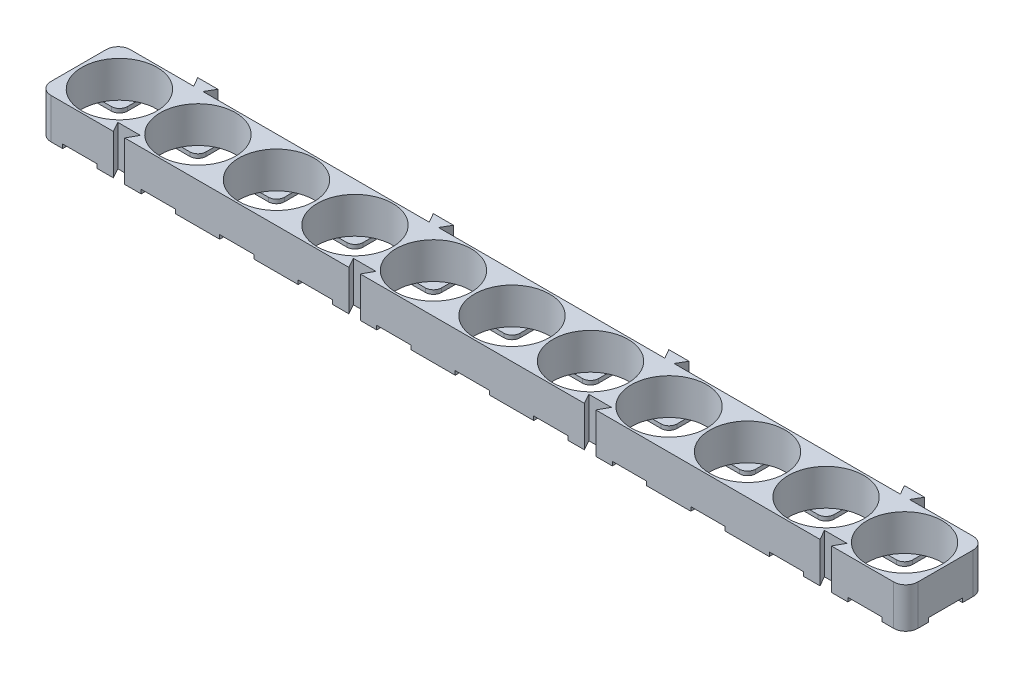
from build123d import *

# Parameters (mm, degrees)
SKETCH3_R           = 9.35
BOSS_EXTRUDE3_DEPTH = 10
SKETCH3_4_R         = 9.35
BOSS_EXTRUDE6_DEPTH = 1
SKETCH8_W           = 215.3
SKETCH8_H           = 8.5
SKETCH8_W_2         = 8.5
SKETCH8_H_2         = 19.7
CUT_EXTRUDE4_DEPTH  = 206.709412765
FILLET3_R           = 2
FILLET4_R           = 3


with BuildPart() as part:
    # Sketch3 → Boss-Extrude3 (new body)
    with BuildSketch(Plane(origin=(0, 0, 0), x_dir=(1, 0, 0), z_dir=(0, 1, 0))):
        Polygon((8.606773133, 9.85), (-10.15, 9.85), (-10.15, -9.85), (8.335772629, -9.85), (6.95, -7.35), (12.55, -7.35), (11.164227371, -9.85), (66.835772629, -9.85), (65.45, -7.35), (71.05, -7.35), (69.664227371, -9.85), (125.335772629, -9.85), (123.95, -7.35), (129.55, -7.35), (128.164227371, -9.85), (183.835772629, -9.85), (182.45, -7.35), (188.05, -7.35), (186.664227371, -9.85), (205.15, -9.85), (205.15, 9.85), (186.393226867, 9.85), (187.75, 12.2), (182.75, 12.2), (184.106773133, 9.85), (127.893226867, 9.85), (129.25, 12.2), (124.25, 12.2), (125.606773133, 9.85), (69.393226867, 9.85), (70.75, 12.2), (65.75, 12.2), (67.106773133, 9.85), (10.893226867, 9.85), (12.25, 12.2), (7.25, 12.2), align=None)
        Circle(SKETCH3_R, mode=Mode.SUBTRACT)
        with Locations((19.5, 0)):
            Circle(SKETCH3_R, mode=Mode.SUBTRACT)
        with Locations((39, 0)):
            Circle(SKETCH3_R, mode=Mode.SUBTRACT)
        with Locations((58.5, 0)):
            Circle(SKETCH3_R, mode=Mode.SUBTRACT)
        with Locations((78, 0)):
            Circle(SKETCH3_R, mode=Mode.SUBTRACT)
        with Locations((97.5, 0)):
            Circle(SKETCH3_R, mode=Mode.SUBTRACT)
        with Locations((117, 0)):
            Circle(SKETCH3_R, mode=Mode.SUBTRACT)
        with Locations((136.5, 0)):
            Circle(SKETCH3_R, mode=Mode.SUBTRACT)
        with Locations((156, 0)):
            Circle(SKETCH3_R, mode=Mode.SUBTRACT)
        with Locations((175.5, 0)):
            Circle(SKETCH3_R, mode=Mode.SUBTRACT)
        with Locations((195, 0)):
            Circle(SKETCH3_R, mode=Mode.SUBTRACT)
    extrude(amount=BOSS_EXTRUDE3_DEPTH)

    # Sketch3<4> → Boss-Extrude6 (add)
    with BuildSketch(Plane(origin=(0, 0, 0), x_dir=(1, 0, 0), z_dir=(0, 1, 0))):
        Circle(SKETCH3_4_R)
        with Locations((19.5, 0)):
            Circle(SKETCH3_4_R)
        with Locations((39, 0)):
            Circle(SKETCH3_4_R)
        with Locations((58.5, 0)):
            Circle(SKETCH3_4_R)
        with Locations((78, 0)):
            Circle(SKETCH3_4_R)
        with Locations((97.5, 0)):
            Circle(SKETCH3_4_R)
        with Locations((117, 0)):
            Circle(SKETCH3_4_R)
        with Locations((136.5, 0)):
            Circle(SKETCH3_4_R)
        with Locations((156, 0)):
            Circle(SKETCH3_4_R)
        with Locations((175.5, 0)):
            Circle(SKETCH3_4_R)
        with Locations((195, 0)):
            Circle(SKETCH3_4_R)
    extrude(amount=BOSS_EXTRUDE6_DEPTH)

    # Sketch8 → Cut-Extrude4 (cut, through all)
    with BuildSketch(Plane(origin=(0, 1, 0), x_dir=(1, 0, 0), z_dir=(0, 1, 0))):
        with Locations((97.5, 0)):
            Rectangle(SKETCH8_W, SKETCH8_H)
        Rectangle(SKETCH8_W_2, SKETCH8_H_2)
        with Locations((19.5, 0)):
            Rectangle(SKETCH8_W_2, SKETCH8_H_2)
        with Locations((39, 0)):
            Rectangle(SKETCH8_W_2, SKETCH8_H_2)
        with Locations((58.5, 0)):
            Rectangle(SKETCH8_W_2, SKETCH8_H_2)
        with Locations((78, 0)):
            Rectangle(SKETCH8_W_2, SKETCH8_H_2)
        with Locations((97.5, 0)):
            Rectangle(SKETCH8_W_2, SKETCH8_H_2)
        with Locations((117, 0)):
            Rectangle(SKETCH8_W_2, SKETCH8_H_2)
        with Locations((136.5, 0)):
            Rectangle(SKETCH8_W_2, SKETCH8_H_2)
        with Locations((156, 0)):
            Rectangle(SKETCH8_W_2, SKETCH8_H_2)
        with Locations((175.5, 0)):
            Rectangle(SKETCH8_W_2, SKETCH8_H_2)
        with Locations((195, 0)):
            Rectangle(SKETCH8_W_2, SKETCH8_H_2)
    extrude(amount=-CUT_EXTRUDE4_DEPTH, mode=Mode.SUBTRACT)

    # Fillet3
    fillet3_edges = [part.edges().sort_by_distance(p)[0] for p in [
        (4.25, 0.5, -4.25),
        (-4.25, 0.5, -4.25),
        (4.25, 0.5, 4.25),
        (-4.25, 0.5, 4.25),
        (190.75, 0.5, -4.25),
        (190.75, 0.5, 4.25),
        (171.25, 0.5, -4.25),
        (171.25, 0.5, 4.25),
        (151.75, 0.5, 4.25),
        (151.75, 0.5, -4.25),
        (132.25, 0.5, -4.25),
        (132.25, 0.5, 4.25),
        (112.75, 0.5, -4.25),
        (93.25, 0.5, 4.25),
        (93.25, 0.5, -4.25),
        (73.75, 0.5, 4.25),
        (73.75, 0.5, -4.25),
        (54.25, 0.5, -4.25),
        (54.25, 0.5, 4.25),
        (34.75, 0.5, 4.25),
        (62.75, 0.5, -4.25),
        (62.75, 0.5, 4.25),
        (82.25, 0.5, -4.25),
        (82.25, 0.5, 4.25),
        (101.75, 0.5, -4.25),
        (101.75, 0.5, 4.25),
        (121.25, 0.5, -4.25),
        (121.25, 0.5, 4.25),
        (140.75, 0.5, 4.25),
        (140.75, 0.5, -4.25),
        (160.25, 0.5, -4.25),
        (160.25, 0.5, 4.25),
        (179.75, 0.5, 4.25),
        (179.75, 0.5, -4.25),
        (199.25, 0.5, -4.25),
        (199.25, 0.5, 4.25),
        (43.25, 0.5, 4.25),
        (43.25, 0.5, -4.25),
        (23.75, 0.5, -4.25),
        (23.75, 0.5, 4.25),
        (15.25, 0.5, 4.25),
        (15.25, 0.5, -4.25),
        (34.75, 0.5, -4.25),
        (112.75, 0.5, 4.25),
    ]]
    fillet(fillet3_edges, radius=FILLET3_R)

    # Fillet4
    fillet4_edges = [part.edges().sort_by_distance(p)[0] for p in [
        (205.15, 5, 9.85),
        (205.15, 5, -9.85),
        (-10.15, 5, 9.85),
        (-10.15, 5, -9.85),
    ]]
    fillet(fillet4_edges, radius=FILLET4_R)


solid = part.part
